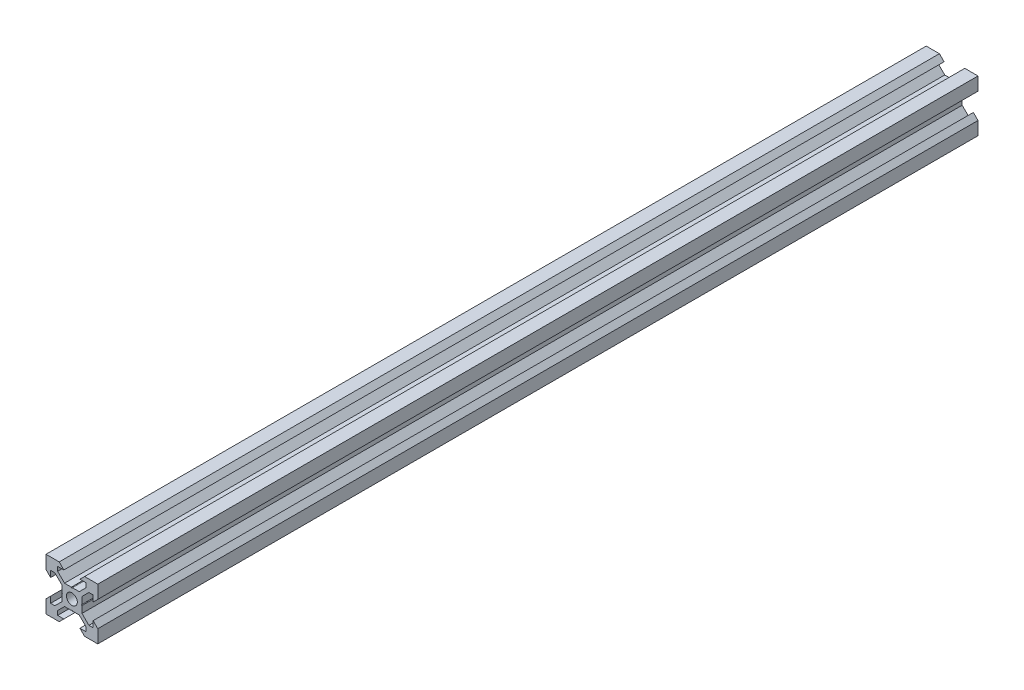
from build123d import *

# Parameters (mm, degrees)
SKETCH1_R           = 2.1
BOSS_EXTRUDE1_DEPTH = 340
CUT_EXTRUDE1_DEPTH  = 340


# Read off the part's stored shape, not the designer's step: Cut-Extrude1
with BuildPart() as part:
    # Sketch1 → Boss-Extrude1 (new body)
    with BuildSketch(Plane.XY):
        Polygon((-10, -4.9), (-10, -10), (-4.9, -10), (-3.1, -8.2), (-5.499339828, -8.2), (-5.499339828, -6.56), (-2.84, -3.900660172), (2.84, -3.900660172), (5.499339828, -6.56), (5.499339828, -8.2), (3.1, -8.2), (4.9, -10), (10, -10), (10, -4.9), (8.2, -3.1), (8.2, -5.499339828), (6.56, -5.499339828), (3.900660172, -2.84), (3.900660172, 2.84), (6.56, 5.499339828), (8.2, 5.499339828), (8.2, 3.1), (10, 4.9), (10, 10), (4.9, 10), (3.1, 8.2), (5.499339828, 8.2), (5.499339828, 6.56), (2.84, 3.900660172), (-2.84, 3.900660172), (-5.499339828, 6.56), (-5.499339828, 8.2), (-3.1, 8.2), (-4.9, 10), (-10, 10), (-10, 4.9), (-8.2, 3.1), (-8.2, 5.499339828), (-6.56, 5.499339828), (-3.900660172, 2.84), (-3.900660172, -2.84), (-6.56, -5.499339828), (-8.2, -5.499339828), (-8.2, -3.1), align=None)
        Circle(SKETCH1_R, mode=Mode.SUBTRACT)
    extrude(amount=BOSS_EXTRUDE1_DEPTH)

    # Cut-Extrude1 outline → Cut-Extrude1 (cut)
    with BuildSketch(Plane.XY):
        with BuildLine():
            ThreePointArc((-3.900660172, -0.2), (-3.700660172, 0), (-3.900660172, 0.2))
            Line((-3.900660172, 0.2), (-3.900660172, -0.2))
        make_face()
        with BuildLine():
            ThreePointArc((-0.2, 3.900660172), (0, 3.700660172), (0.2, 3.900660172))
            Line((0.2, 3.900660172), (-0.2, 3.900660172))
        make_face()
        with BuildLine():
            ThreePointArc((3.900660172, 0.2), (3.700660172, 0), (3.900660172, -0.2))
            Line((3.900660172, -0.2), (3.900660172, 0.2))
        make_face()
        with BuildLine():
            ThreePointArc((0.2, -3.900660172), (0, -3.700660172), (-0.2, -3.900660172))
            Line((-0.2, -3.900660172), (0.2, -3.900660172))
        make_face()
    extrude(amount=CUT_EXTRUDE1_DEPTH, mode=Mode.SUBTRACT)


solid = part.part
